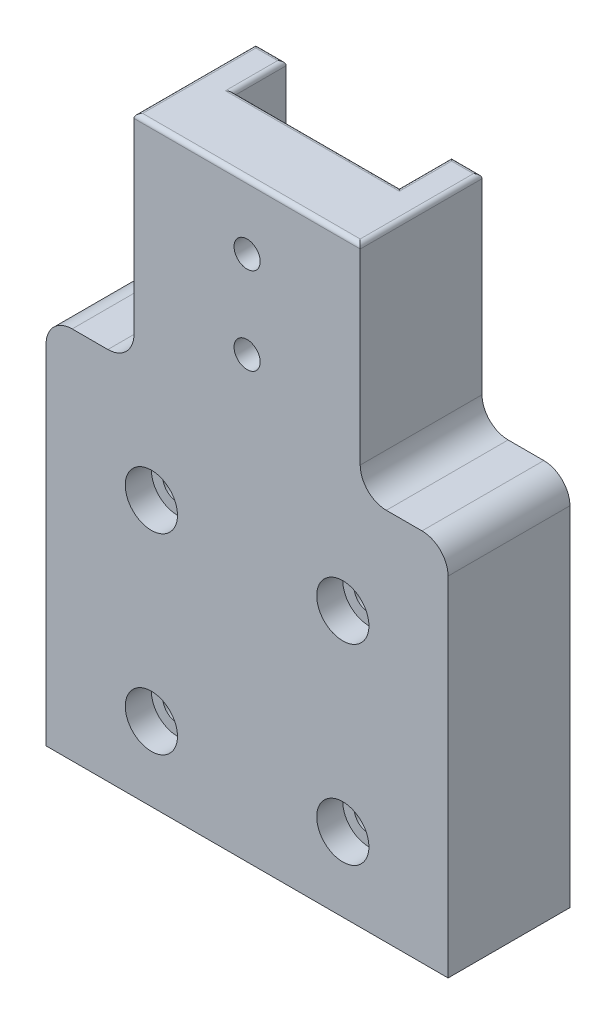
from build123d import *

# Parameters (mm, degrees)
SKETCH1_W           = 46.2
SKETCH1_H           = 14
BOSS_EXTRUDE1_DEPTH = 43
SKETCH10_W          = 26
SKETCH10_H          = 14
BOSS_EXTRUDE4_DEPTH = 25
SKETCH11_W          = 19
SKETCH11_H          = 6
CUT_EXTRUDE2_DEPTH  = 25
FILLET1_R           = 3
FILLET2_R           = 0.5
SKETCH12_R          = 1.5
CUT_EXTRUDE3_DEPTH  = 10
SKETCH13_W          = 40.6
SKETCH13_H          = 4.4
CUT_EXTRUDE4_DEPTH  = 40
SKETCH14_R          = 1.7
CUT_EXTRUDE6_DEPTH  = 20
CUT_EXTRUDE7_DEPTH  = 4
SKETCH16_R          = 3
CUT_EXTRUDE8_DEPTH  = 3


with BuildPart() as part:
    # Sketch1 → Boss-Extrude1 (new body)
    with BuildSketch(Plane(origin=(0, 0, 0), x_dir=(1, 0, 0), z_dir=(0, 1, 0))):
        Rectangle(SKETCH1_W, SKETCH1_H)
    extrude(amount=BOSS_EXTRUDE1_DEPTH)

    # Sketch10 → Boss-Extrude4 (add)
    with BuildSketch(Plane(origin=(0, 43, 0), x_dir=(1, 0, 0), z_dir=(0, 1, 0))):
        Rectangle(SKETCH10_W, SKETCH10_H)
    extrude(amount=BOSS_EXTRUDE4_DEPTH)

    # Sketch11 → Cut-Extrude2 (cut)
    with BuildSketch(Plane(origin=(0, 68, 0), x_dir=(1, 0, 0), z_dir=(0, 1, 0))):
        with Locations((0, 4)):
            Rectangle(SKETCH11_W, SKETCH11_H)
    extrude(amount=-CUT_EXTRUDE2_DEPTH, mode=Mode.SUBTRACT)

    # Fillet1
    fillet1_edges = [part.edges().sort_by_distance(p)[0] for p in [
        (-13, 43, 0),
        (13, 43, 0),
        (23.1, 43, 0),
        (-23.1, 43, 0),
    ]]
    fillet(fillet1_edges, radius=FILLET1_R)

    # Fillet2
    fillet2_edges = [part.edges().sort_by_distance(p)[0] for p in [
        (-13, 68, 0),
        (-11.25, 68, -7),
        (-9.5, 68, -4),
        (0, 68, -1),
        (9.5, 68, -4),
        (11.25, 68, -7),
        (13, 68, 0),
        (0, 68, 7),
    ]]
    fillet(fillet2_edges, radius=FILLET2_R)

    # Sketch12 → Cut-Extrude3 (cut, symmetric)
    with BuildSketch(Plane.XY):
        with Locations((0, 50.5)):
            Circle(SKETCH12_R)
        with Locations((0, 60.5)):
            Circle(SKETCH12_R)
    extrude(amount=CUT_EXTRUDE3_DEPTH, both=True, mode=Mode.SUBTRACT)

    # Sketch13 → Cut-Extrude4 (cut)
    with BuildSketch(Plane(origin=(0, 0, 0), x_dir=(-1, 0, 0), z_dir=(0, -1, 0))):
        Rectangle(SKETCH13_W, SKETCH13_H)
    extrude(amount=-CUT_EXTRUDE4_DEPTH, mode=Mode.SUBTRACT)

    # Sketch14 → Cut-Extrude6 (cut, symmetric)
    with BuildSketch(Plane.XY):
        with Locations((-11, 30.5)):
            Circle(SKETCH14_R)
        with Locations((11, 30.5)):
            Circle(SKETCH14_R)
        with Locations((11, 8.5)):
            Circle(SKETCH14_R)
        with Locations((-11, 8.5)):
            Circle(SKETCH14_R)
    extrude(amount=CUT_EXTRUDE6_DEPTH, both=True, mode=Mode.SUBTRACT)

    # Sketch15 → Cut-Extrude7 (cut)
    with BuildSketch(Plane(origin=(0, 0, -7), x_dir=(-1, 0, 0), z_dir=(0, 0, -1))):
        Polygon((-11, 33.675426481), (-13.75, 32.08771324), (-13.75, 28.91228676), (-11, 27.324573519), (-8.25, 28.91228676), (-8.25, 32.08771324), align=None)
        Polygon((11, 33.675426481), (8.25, 32.08771324), (8.25, 28.91228676), (11, 27.324573519), (13.75, 28.91228676), (13.75, 32.08771324), align=None)
        Polygon((11, 11.675426481), (8.25, 10.08771324), (8.25, 6.91228676), (11, 5.324573519), (13.75, 6.91228676), (13.75, 10.08771324), align=None)
        Polygon((-11, 11.675426481), (-13.75, 10.08771324), (-13.75, 6.91228676), (-11, 5.324573519), (-8.25, 6.91228676), (-8.25, 10.08771324), align=None)
    extrude(amount=-CUT_EXTRUDE7_DEPTH, mode=Mode.SUBTRACT)

    # Sketch16 → Cut-Extrude8 (cut)
    with BuildSketch(Plane.XY.offset(7)):
        with Locations((-11, 30.5)):
            Circle(SKETCH16_R)
        with Locations((11, 30.5)):
            Circle(SKETCH16_R)
        with Locations((11, 8.5)):
            Circle(SKETCH16_R)
        with Locations((-11, 8.5)):
            Circle(SKETCH16_R)
    extrude(amount=-CUT_EXTRUDE8_DEPTH, mode=Mode.SUBTRACT)


solid = part.part
